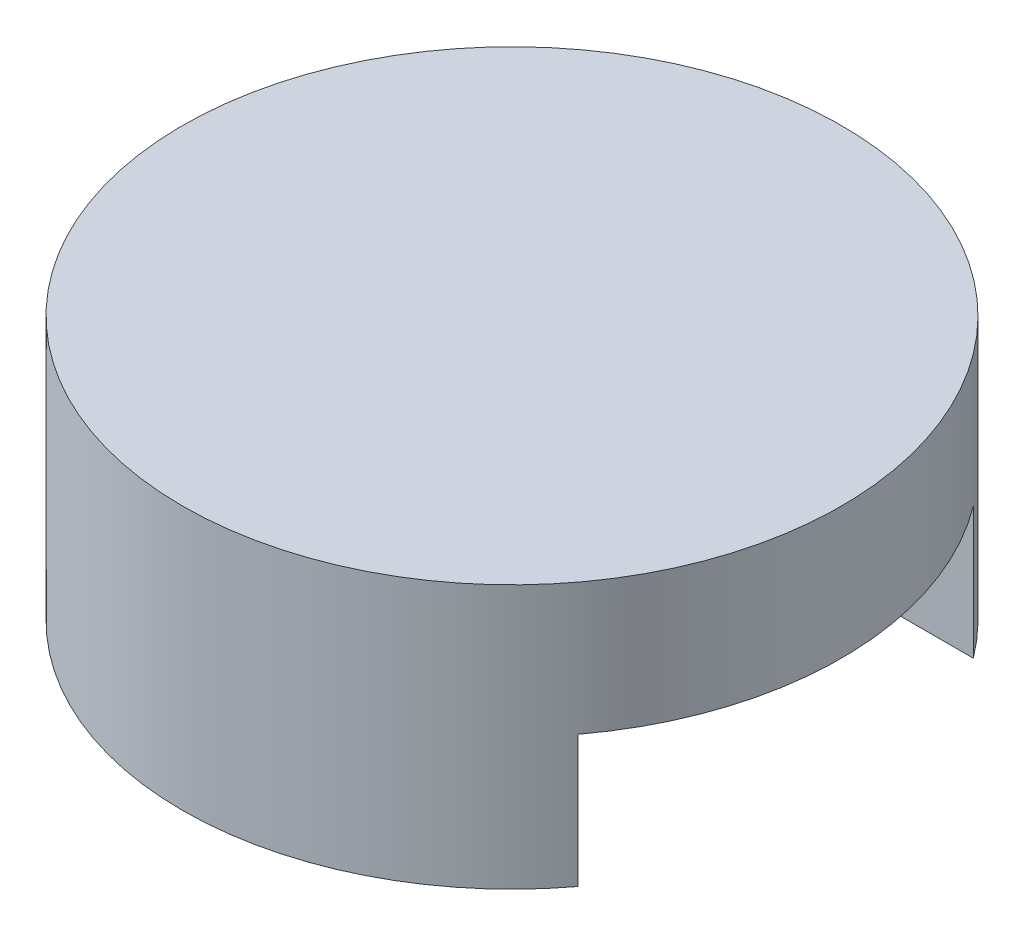
from build123d import *

# Parameters (mm, degrees)
SKETCH1_R               = 15.875
BOSS_EXTRUDE1_DEPTH     = 12.7
CUT_EXTRUDE1_DEPTH      = 26.793821935
CUT_EXTRUDE1_DEPTH_BACK = 26.793821935
SKETCH2_W               = 19.05
SKETCH2_H               = 6.35


with BuildPart() as part:
    # Sketch1 → Boss-Extrude1 (new body)
    with BuildSketch(Plane(origin=(0, 0, 0), x_dir=(1, 0, 0), z_dir=(0, 1, 0))):
        Circle(SKETCH1_R)
    extrude(amount=BOSS_EXTRUDE1_DEPTH)

    # Sketch2 → Cut-Extrude1 (cut, two sides: drawn at the far end of the back side and taken through both)
    with BuildSketch(Plane(origin=(0, 0, 0), x_dir=(0, 0, -1), z_dir=(1, 0, 0)).offset(-CUT_EXTRUDE1_DEPTH_BACK)):
        with Locations((0, 3.175)):
            Rectangle(SKETCH2_W, SKETCH2_H)
    extrude(amount=CUT_EXTRUDE1_DEPTH + CUT_EXTRUDE1_DEPTH_BACK, mode=Mode.SUBTRACT)


solid = part.part
